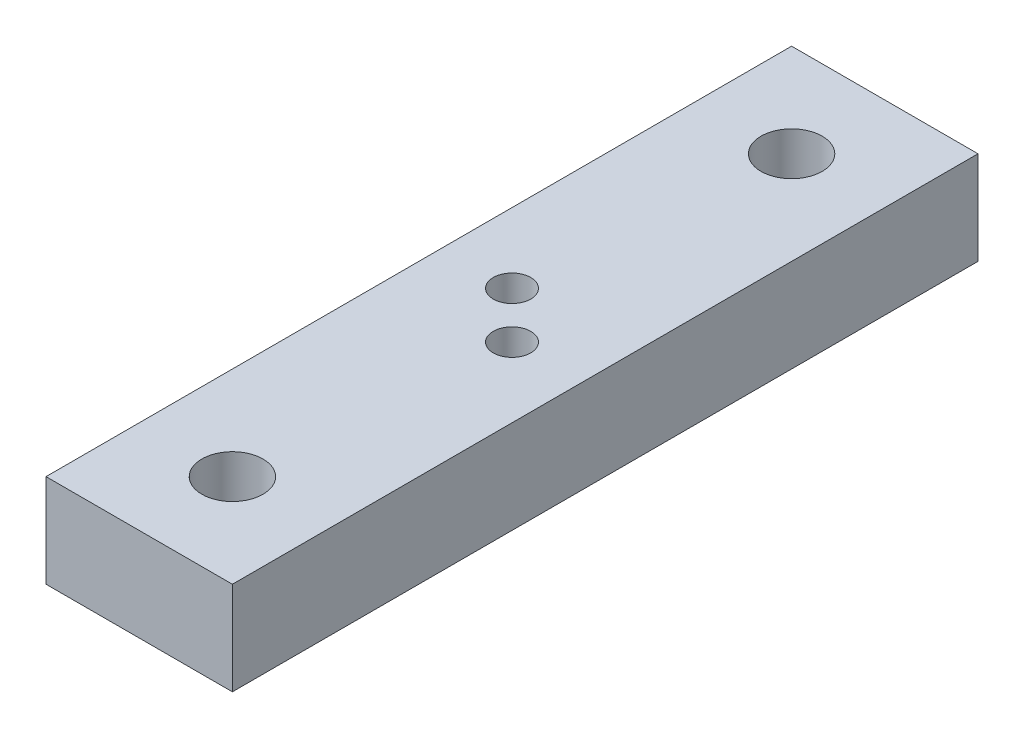
from build123d import *

# Parameters (mm, degrees)
SKETCH1_W                                   = 25.4
SKETCH1_H                                   = 101.6
SKETCH1_R                                   = 4.1656
BOSS_EXTRUDE1_DEPTH                         = 12.7
CBORE_FOR_10_HEX_MACHINE_SCREW1_D           = 5.1054
CBORE_FOR_10_HEX_MACHINE_SCREW1_CBORE_D     = 14.2875
CBORE_FOR_10_HEX_MACHINE_SCREW1_CBORE_DEPTH = 3.048


with BuildPart() as part:
    # Sketch1 → Boss-Extrude1 (new body)
    with BuildSketch(Plane(origin=(0, 0, 0), x_dir=(1, 0, 0), z_dir=(0, 1, 0))):
        with Locations((12.7, 50.8)):
            Rectangle(SKETCH1_W, SKETCH1_H)
        with Locations((12.7, 88.9)):
            Circle(SKETCH1_R, mode=Mode.SUBTRACT)
        with Locations((12.7, 12.7)):
            Circle(SKETCH1_R, mode=Mode.SUBTRACT)
    extrude(amount=BOSS_EXTRUDE1_DEPTH)

    # CBORE for #10 Hex Machine Screw1 (through all)
    with Locations(Plane(origin=(0, 0, 0), x_dir=(-1, 0, 0), z_dir=(0, -1, 0))):
        with Locations((-15.875, 47.625), (-9.525, 53.975)):
            CounterBoreHole(CBORE_FOR_10_HEX_MACHINE_SCREW1_D / 2, CBORE_FOR_10_HEX_MACHINE_SCREW1_CBORE_D / 2, CBORE_FOR_10_HEX_MACHINE_SCREW1_CBORE_DEPTH)


solid = part.part
